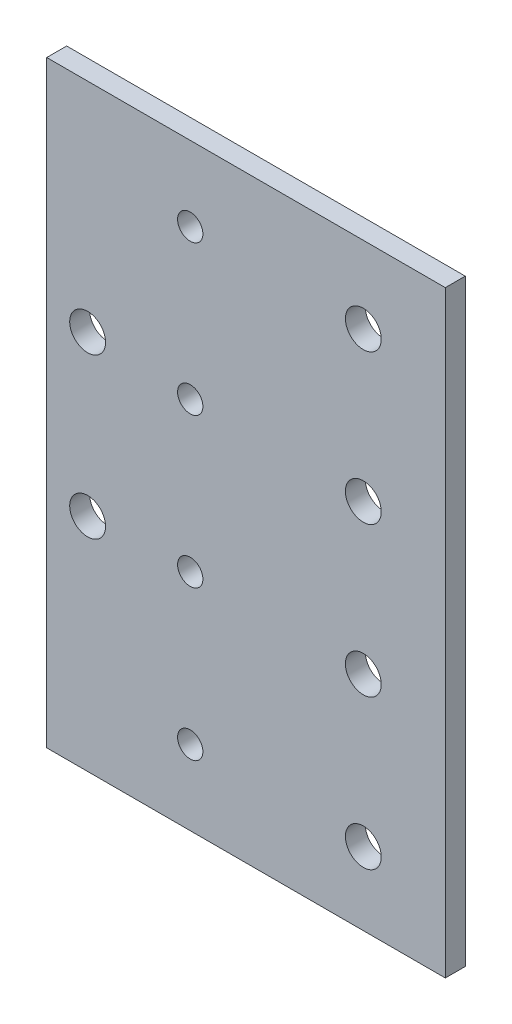
from build123d import *

# Parameters (mm, degrees)
SKETCH2_W           = 100
SKETCH2_H           = 150
BOSS_EXTRUDE1_DEPTH = 5
SKETCH3_R           = 4.5
CUT_EXTRUDE1_DEPTH  = 5
SKETCH6_R           = 3.175
CUT_EXTRUDE2_DEPTH  = 269.528430204


with BuildPart() as part:
    # Sketch2 → Boss-Extrude1 (new body)
    with BuildSketch(Plane.XY):
        with Locations((-173.010889244, -74.49468588)):
            Rectangle(SKETCH2_W, SKETCH2_H)
    extrude(amount=BOSS_EXTRUDE1_DEPTH)

    # Sketch3 → Cut-Extrude1 (cut)
    with BuildSketch(Plane(origin=(0, 0, 0), x_dir=(-1, 0, 0), z_dir=(0, 0, -1))):
        with Locations((212.756022811, -54.012878845)):
            Circle(SKETCH3_R)
        with Locations((212.756022811, -94.012878845)):
            Circle(SKETCH3_R)
        with Locations((143.584758496, -18.75)):
            Circle(SKETCH3_R)
        with Locations((143.584758496, -56.25)):
            Circle(SKETCH3_R)
        with Locations((143.584758496, -93.75)):
            Circle(SKETCH3_R)
        with Locations((143.584758496, -131.25)):
            Circle(SKETCH3_R)
    extrude(amount=-CUT_EXTRUDE1_DEPTH, mode=Mode.SUBTRACT)

    # Sketch6 → Cut-Extrude2 (cut, through all)
    with BuildSketch(Plane.XY.offset(5)):
        with Locations((-187.010889244, -18.24468588)):
            Circle(SKETCH6_R)
        with Locations((-187.010889244, -55.74468588)):
            Circle(SKETCH6_R)
        with Locations((-187.010889244, -93.24468588)):
            Circle(SKETCH6_R)
        with Locations((-187.010889244, -130.74468588)):
            Circle(SKETCH6_R)
    extrude(amount=-CUT_EXTRUDE2_DEPTH, mode=Mode.SUBTRACT)


solid = part.part
